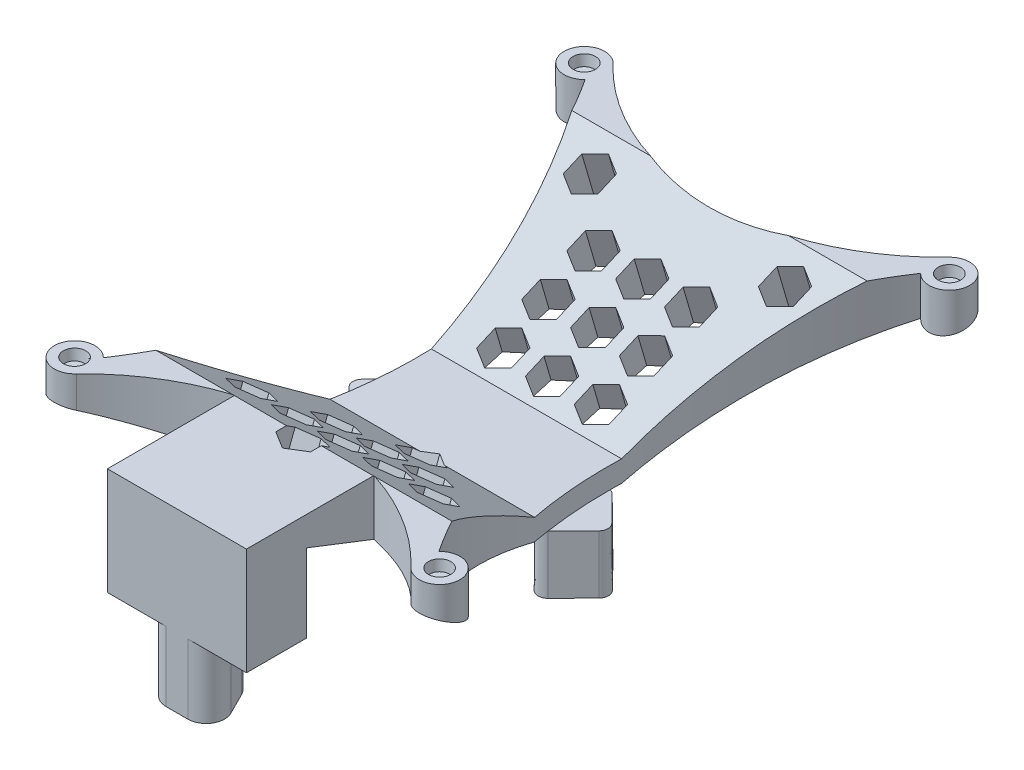
from build123d import *
from build123d.topology import SkipClean

# Parameters (mm, degrees)
BOSS_EXTRUDE1_DEPTH           = 36.5
CUT_EXTRUDE1_DEPTH            = 98.865031656
SKETCH4_R                     = 1.935
CUT_EXTRUDE2_DEPTH            = 1.7526
CUT_EXTRUDE2_DRAFT            = -8
CUT_EXTRUDE2_PROFILE_2_DEPTH  = 1.7526
CUT_EXTRUDE2_PROFILE_2_DRAFT  = -8
CUT_EXTRUDE2_PROFILE_3_DEPTH  = 1.7526
CUT_EXTRUDE2_PROFILE_3_DRAFT  = -8
CUT_EXTRUDE2_PROFILE_4_DEPTH  = 1.7526
CUT_EXTRUDE2_PROFILE_4_DRAFT  = -8
BOSS_EXTRUDE2_DEPTH           = 4.6228
FILLET1_R                     = 3.175
CUT_EXTRUDE4_START            = -18
CUT_EXTRUDE4_DEPTH            = 18
CUT_EXTRUDE6_DEPTH            = 50
CUT_EXTRUDE7_DEPTH            = 100
FILL_START                    = 16.923311585
FILL_PATTERN1_DEPTH           = 7.757240099
CUT_EXTRUDE8_DEPTH            = 100
FILL_START_2                  = 12.114170934
FILL_PATTERN2_DEPTH           = 8.855811696
BOSS_EXTRUDE4_DEPTH           = 10
BOSS_EXTRUDE4_DRAFT           = -0.5
BOSS_EXTRUDE4_PROFILE_2_DEPTH = 10
BOSS_EXTRUDE4_PROFILE_2_DRAFT = -0.5
CUT_EXTRUDE9_DEPTH            = 6


# Read off the part's stored shape, not the designer's step: Fill Pattern1, Fill Pattern2
with BuildPart() as part:
    # Sketch1 → Boss-Extrude1 (new body)
    with BuildSketch(Plane(origin=(0, 0, 0), x_dir=(1, 0, 0), z_dir=(0, 1, 0))):
        with BuildLine():
            Line((-12, -35.838693114), (-12, -57.838693114))
            Line((-12, -57.838693114), (12, -57.838693114))
            Line((12, -57.838693114), (12, -35.838693114))
            ThreePointArc((12, -35.838693114), (21.100135224, -40.014143909), (28.878256635, -46.318719847))
            ThreePointArc((28.878256635, -46.318719847), (34.99938562, -44.065576529), (28.966969845, -41.584682581))
            ThreePointArc((28.966969845, -41.584682581), (16.382626331, 0), (28.966969845, 41.584682581))
            ThreePointArc((28.966969845, 41.584682581), (34.998690641, 44.095727727), (28.838687388, 46.273194928))
            ThreePointArc((28.838687388, 46.273194928), (0, 33.991963114), (-28.838687388, 46.273194928))
            ThreePointArc((-28.838687388, 46.273194928), (-34.998690641, 44.095727727), (-28.966969845, 41.584682581))
            ThreePointArc((-28.966969845, 41.584682581), (-16.382626331, 0), (-28.966969845, -41.584682581))
            ThreePointArc((-28.966969845, -41.584682581), (-34.99938562, -44.065576529), (-28.878256635, -46.318719847))
            ThreePointArc((-28.878256635, -46.318719847), (-21.100135224, -40.014143909), (-12, -35.838693114))
        make_face()
    extrude(amount=BOSS_EXTRUDE1_DEPTH)

    # Sketch2 → Cut-Extrude1 (cut, through all)
    with BuildSketch(Plane(origin=(35, 0, 0), x_dir=(0, 0, -1), z_dir=(1, 0, 0))):
        Polygon((47.5, 31.5), (47.5, 18.360025762), (47.5, 0), (-3.679030534, 0), (-47.5, 0), (-47.5, 18.360025762), (-47.5, 31.5), (-13.761324108, 18.360025762), (2.5, 18.360025762), align=None)
    extrude(amount=-CUT_EXTRUDE1_DEPTH, mode=Mode.SUBTRACT)


with BuildPart() as cut_extrude2_tool:
    # Sketch4 → Cut-Extrude2 (with draft: the straight prism first)
    with BuildSketch(Plane(origin=(0, 36.5, 0), x_dir=(1, 0, 0), z_dir=(0, 1, 0))):
        with Locations((31.5, 44)):
            Circle(SKETCH4_R)
    extrude(amount=-CUT_EXTRUDE2_DEPTH)
    # Cut-Extrude2: the draft: its side faces are tilted about the plane it starts from
    cut_extrude2_sides = [cut_extrude2_tool.faces().sort_by_distance(p)[0] for p in [
        (29.565, 35.6237, -44),
    ]]
    draft(cut_extrude2_sides, Plane(origin=(0, 36.5, 0), x_dir=(1, 0, 0), z_dir=(0, 1, 0)), CUT_EXTRUDE2_DRAFT)


with BuildPart() as part_1:
    add(part.part)

    # Cut-Extrude2: cut by cut_extrude2_tool
    add(cut_extrude2_tool.part, mode=Mode.SUBTRACT)


with BuildPart() as cut_extrude2_profile_2_tool:
    # Sketch4 → Cut-Extrude2 profile 2 (with draft: the straight prism first)
    with BuildSketch(Plane(origin=(0, 36.5, 0), x_dir=(1, 0, 0), z_dir=(0, 1, 0))):
        with Locations((-31.522, 44)):
            Circle(SKETCH4_R)
    extrude(amount=-CUT_EXTRUDE2_PROFILE_2_DEPTH)
    # Cut-Extrude2 profile 2: the draft: its side faces are tilted about the plane it starts from
    cut_extrude2_profile_2_sides = [cut_extrude2_profile_2_tool.faces().sort_by_distance(p)[0] for p in [
        (-33.457, 35.6237, -44),
    ]]
    draft(cut_extrude2_profile_2_sides, Plane(origin=(0, 36.5, 0), x_dir=(1, 0, 0), z_dir=(0, 1, 0)), CUT_EXTRUDE2_PROFILE_2_DRAFT)


with BuildPart() as part_2:
    add(part_1.part)

    # Cut-Extrude2 profile 2: cut by cut_extrude2_profile_2_tool
    add(cut_extrude2_profile_2_tool.part, mode=Mode.SUBTRACT)


with BuildPart() as cut_extrude2_profile_3_tool:
    # Sketch4 → Cut-Extrude2 profile 3 (with draft: the straight prism first)
    with BuildSketch(Plane(origin=(0, 36.5, 0), x_dir=(1, 0, 0), z_dir=(0, 1, 0))):
        with Locations((-31.522, -44)):
            Circle(SKETCH4_R)
    extrude(amount=-CUT_EXTRUDE2_PROFILE_3_DEPTH)
    # Cut-Extrude2 profile 3: the draft: its side faces are tilted about the plane it starts from
    cut_extrude2_profile_3_sides = [cut_extrude2_profile_3_tool.faces().sort_by_distance(p)[0] for p in [
        (-33.457, 35.6237, 44),
    ]]
    draft(cut_extrude2_profile_3_sides, Plane(origin=(0, 36.5, 0), x_dir=(1, 0, 0), z_dir=(0, 1, 0)), CUT_EXTRUDE2_PROFILE_3_DRAFT)


with BuildPart() as part_3:
    add(part_2.part)

    # Cut-Extrude2 profile 3: cut by cut_extrude2_profile_3_tool
    add(cut_extrude2_profile_3_tool.part, mode=Mode.SUBTRACT)


with BuildPart() as cut_extrude2_profile_4_tool:
    # Sketch4 → Cut-Extrude2 profile 4 (with draft: the straight prism first)
    with BuildSketch(Plane(origin=(0, 36.5, 0), x_dir=(1, 0, 0), z_dir=(0, 1, 0))):
        with Locations((31.5, -44)):
            Circle(SKETCH4_R)
    extrude(amount=-CUT_EXTRUDE2_PROFILE_4_DEPTH)
    # Cut-Extrude2 profile 4: the draft: its side faces are tilted about the plane it starts from
    cut_extrude2_profile_4_sides = [cut_extrude2_profile_4_tool.faces().sort_by_distance(p)[0] for p in [
        (29.565, 35.6237, 44),
    ]]
    draft(cut_extrude2_profile_4_sides, Plane(origin=(0, 36.5, 0), x_dir=(1, 0, 0), z_dir=(0, 1, 0)), CUT_EXTRUDE2_PROFILE_4_DRAFT)


with BuildPart() as part_4:
    add(part_3.part)

    # Cut-Extrude2 profile 4: cut by cut_extrude2_profile_4_tool
    add(cut_extrude2_profile_4_tool.part, mode=Mode.SUBTRACT)

    # Sketch9 → Boss-Extrude2 (add)
    with BuildSketch(Plane.XZ):
        Polygon((7, 57.838693114), (-7, 57.838693114), (0, 43.838693114), align=None)
    extrude(amount=BOSS_EXTRUDE2_DEPTH)

    # Fillet1
    # the kernel refuses this fillet: 3.175 mm, written as the material it takes off along each edge
    with BuildSketch(Plane(origin=(0, 0, 43.838693114), x_dir=(0.44721359549995787, 0, 0.8944271909999159), z_dir=(0, -1, 0))) as fillet1_piece_1:
        with BuildLine():
            CenterArc((FILLET1_R * 2, FILLET1_R), FILLET1_R, 143.130102354, 126.869897646)
            Line((FILLET1_R * 1.2, FILLET1_R * 1.6), (0, 0))
            Line((0, 0), (FILLET1_R * 2, 0))
        make_face()
    extrude(amount=20.4978, mode=Mode.SUBTRACT)
    with BuildSketch(Plane(origin=(7, 0, 57.838693114), x_dir=(-1, 0, 0), z_dir=(0, -1, 0))) as fillet1_piece_2:
        with BuildLine():
            CenterArc((FILLET1_R * 1.61803398875, FILLET1_R), FILLET1_R, 153.434948823, 116.565051177)
            Line((FILLET1_R * 0.72360679775, FILLET1_R * 1.4472135955), (0, 0))
            Line((0, 0), (FILLET1_R * 1.61803398875, 0))
        make_face()
    extrude(amount=17.465944786, mode=Mode.SUBTRACT)
    with BuildSketch(Plane(origin=(-7, 0, 57.838693114), x_dir=(1, 0, 0), z_dir=(0, -1, 0))) as fillet1_piece_3:
        with BuildLine():
            CenterArc((FILLET1_R * 1.61803398875, -FILLET1_R), FILLET1_R, 90, 116.565051177)
            Line((FILLET1_R * 0.72360679775, -FILLET1_R * 1.4472135955), (0, 0))
            Line((0, 0), (FILLET1_R * 1.61803398875, 0))
        make_face()
    extrude(amount=17.465944786, mode=Mode.SUBTRACT)

    # Sketch23 → Cut-Extrude4 (cut)
    with SkipClean():  # the faces are left unmerged after this step: merging them gives an invalid solid
        with BuildSketch(Plane.XZ.offset(CUT_EXTRUDE4_START)):
            with BuildLine():
                ThreePointArc((1.862742086, 57.838693114), (4.563558402, 56.332889395), (4.702548417, 53.243789948))
                Line((4.702548417, 53.243789948), (2.839806331, 49.518305777))
                ThreePointArc((2.839806331, 49.518305777), (0, 47.763208942), (-2.839806331, 49.518305777))
                Line((-2.839806331, 49.518305777), (-4.702548417, 53.243789948))
                ThreePointArc((-4.702548417, 53.243789948), (-4.563558402, 56.332889395), (-1.862742086, 57.838693114))
                Line((-1.862742086, 57.838693114), (-12, 57.838693114))
                Line((-12, 57.838693114), (-12, 47.5))
                Line((-12, 47.5), (12, 47.5))
                Line((12, 47.5), (12, 57.838693114))
                Line((12, 57.838693114), (1.862742086, 57.838693114))
            make_face()
        extrude(amount=CUT_EXTRUDE4_DEPTH, mode=Mode.SUBTRACT)

    # Sketch15 → Cut-Extrude6 (cut, symmetric)
    with BuildSketch(Plane(origin=(-12.359159139, 18.360025762, 1.236220339), x_dir=(0, 0, 1), z_dir=(-1, 0, 0))):
        Polygon((-37.052321788, 18.139974238), (-3.736220339, 3.674033336), (12.525103769, 3.674033336), (34.69981047, 18.139974238), align=None)
    extrude(amount=CUT_EXTRUDE6_DEPTH, both=True, mode=Mode.SUBTRACT)

    # Sketch25 → Cut-Extrude7 (cut)
    with BuildSketch(Plane(origin=(0, 16.244925312, 4.743508891), x_dir=(-1, 0, 0), z_dir=(0, -0.9599140942773268, -0.28029436599357355))):
        Polygon((0, 9.894732418), (3, 11.626783225), (3, 15.09088484), (0, 16.822935648), (-3, 15.09088484), (-3, 11.626783225), align=None)
    extrude(amount=-CUT_EXTRUDE7_DEPTH, mode=Mode.SUBTRACT)

    # Fill Pattern1 outline → Fill Pattern1 (cut)
    with BuildSketch(Plane(origin=(0, 0, 0), x_dir=(1, 0, 0), z_dir=(0, 0.9599140942773268, 0.2802943659935737)).offset(FILL_START)):
        Polygon((0, 26.744253388), (3, 28.476304195), (3, 31.940405811), (0, 33.672456618), (-3, 31.940405811), (-3, 28.476304195), align=None)
        Polygon((0, 18.319492903), (3, 20.05154371), (3, 23.515645326), (0, 25.247696133), (-3, 23.515645326), (-3, 20.05154371), align=None)
        Polygon((5.424760485, 11.626783225), (8.424760485, 9.894732418), (11.424760485, 11.626783225), (11.424760485, 15.09088484), (8.424760485, 16.822935648), (5.424760485, 15.09088484), align=None)
        Polygon((8.424760485, 26.744253388), (11.424760485, 28.476304195), (11.424760485, 31.940405811), (8.424760485, 33.672456618), (5.424760485, 31.940405811), (5.424760485, 28.476304195), align=None)
        Polygon((8.424760485, 18.319492903), (11.424760485, 20.05154371), (11.424760485, 23.515645326), (8.424760485, 25.247696133), (5.424760485, 23.515645326), (5.424760485, 20.05154371), align=None)
        Polygon((-11.424760485, 28.476304195), (-8.424760485, 26.744253388), (-5.424760485, 28.476304195), (-5.424760485, 31.940405811), (-8.424760485, 33.672456618), (-11.424760485, 31.940405811), align=None)
        Polygon((-8.424760485, 18.319492903), (-5.424760485, 20.05154371), (-5.424760485, 23.515645326), (-8.424760485, 25.247696133), (-11.424760485, 23.515645326), (-11.424760485, 20.05154371), align=None)
        Polygon((-8.424760485, 9.894732418), (-5.424760485, 11.626783225), (-5.424760485, 15.09088484), (-8.424760485, 16.822935648), (-11.424760485, 15.09088484), (-11.424760485, 11.626783225), align=None)
        Polygon((13.84952097, 36.90106468), (16.84952097, 35.169013873), (19.84952097, 36.90106468), (19.84952097, 40.365166296), (16.84952097, 42.097217103), (13.84952097, 40.365166296), align=None)
        Polygon((-19.84952097, 36.90106468), (-16.84952097, 35.169013873), (-13.84952097, 36.90106468), (-13.84952097, 40.365166296), (-16.84952097, 42.097217103), (-19.84952097, 40.365166296), align=None)
    extrude(amount=FILL_PATTERN1_DEPTH, mode=Mode.SUBTRACT)

    # Sketch26 → Cut-Extrude8 (cut)
    with SkipClean():  # the faces are left unmerged after this step: merging them gives an invalid solid
        with BuildSketch(Plane(origin=(0, 11.288272361, -4.396367198), x_dir=(1, 0, 0), z_dir=(0, -0.9318237642182001, 0.36291110817695343))):
            Polygon((0, 26.535681859), (-3, 24.803631051), (-3, 21.339529436), (0, 19.607478629), (3, 21.339529436), (3, 24.803631051), align=None)
        extrude(amount=-CUT_EXTRUDE8_DEPTH, mode=Mode.SUBTRACT)

    # Fill Pattern2 outline → Fill Pattern2 (cut)
    with SkipClean():  # the faces are left unmerged after this step: merging them gives an invalid solid
        with BuildSketch(Plane(origin=(0, 0, 0), x_dir=(1, 0, 0), z_dir=(0, 0.9318237642182, -0.3629111081769533)).offset(FILL_START_2)):
            Polygon((0, -42.297607089), (3, -40.565556281), (3, -37.101454666), (0, -35.369403859), (-3, -37.101454666), (-3, -40.565556281), align=None)
            Polygon((0, -50.178569704), (3, -48.446518896), (3, -44.982417281), (0, -43.250366474), (-3, -44.982417281), (-3, -48.446518896), align=None)
            Polygon((0, -34.416644474), (3, -32.684593666), (3, -29.220492051), (0, -27.488441244), (-3, -29.220492051), (-3, -32.684593666), align=None)
            Polygon((4.880962615, -32.684593666), (7.880962615, -34.416644474), (10.880962615, -32.684593666), (10.880962615, -29.220492051), (7.880962615, -27.488441244), (4.880962615, -29.220492051), align=None)
            Polygon((7.880962615, -42.297607089), (10.880962615, -40.565556281), (10.880962615, -37.101454666), (7.880962615, -35.369403859), (4.880962615, -37.101454666), (4.880962615, -40.565556281), align=None)
            Polygon((-10.880962615, -40.565556281), (-7.880962615, -42.297607089), (-4.880962615, -40.565556281), (-4.880962615, -37.101454666), (-7.880962615, -35.369403859), (-10.880962615, -37.101454666), align=None)
            Polygon((-7.880962615, -34.416644474), (-4.880962615, -32.684593666), (-4.880962615, -29.220492051), (-7.880962615, -27.488441244), (-10.880962615, -29.220492051), (-10.880962615, -32.684593666), align=None)
            Polygon((12.76192523, -40.565556281), (15.76192523, -42.297607089), (18.76192523, -40.565556281), (18.76192523, -37.101454666), (15.76192523, -35.369403859), (12.76192523, -37.101454666), align=None)
            Polygon((-18.76192523, -40.565556281), (-15.76192523, -42.297607089), (-12.76192523, -40.565556281), (-12.76192523, -37.101454666), (-15.76192523, -35.369403859), (-18.76192523, -37.101454666), align=None)
        extrude(amount=FILL_PATTERN2_DEPTH, mode=Mode.SUBTRACT)


with BuildPart() as boss_extrude4_tool:
    # Sketch30 → Boss-Extrude4 (with draft: the straight prism first)
    with BuildSketch(Plane.XZ.offset(-18.360025762)):
        with BuildLine():
            Line((-17.198920753, 10.984248026), (-21.557475794, 6.55791926))
            ThreePointArc((-21.557475794, 6.55791926), (-22.013817318, 5.444080515), (-21.557475794, 4.330241769))
            Line((-21.557475794, 4.330241769), (-17.198920753, -0.096086997))
            ThreePointArc((-17.198920753, -0.096086997), (-15.465914219, -0.451239458), (-14.480262276, 1.017751749))
            Line((-14.480262276, 1.017751749), (-14.480262276, 9.87040928))
            ThreePointArc((-14.480262276, 9.87040928), (-15.465914219, 11.339400487), (-17.198920753, 10.984248026))
        make_face()
    extrude(amount=BOSS_EXTRUDE4_DEPTH)
    # Boss-Extrude4: the draft: its side faces are tilted about the plane it starts from
    boss_extrude4_sides = [boss_extrude4_tool.faces().sort_by_distance(p)[0] for p in [
        (-19.378198273, 13.360025762, 8.771083643),
        (-22.013817318, 13.360025762, 5.444080515),
        (-19.378198273, 13.360025762, 2.117077386),
        (-15.465914219, 13.360025762, -0.451239458),
        (-14.480262276, 13.360025762, 5.444080515),
        (-15.465914219, 13.360025762, 11.339400487),
    ]]
    draft(boss_extrude4_sides, Plane.XZ.offset(-18.360025762), BOSS_EXTRUDE4_DRAFT)


with BuildPart() as part_5:
    add(part_4.part)

    # Boss-Extrude4: add boss_extrude4_tool
    add(boss_extrude4_tool.part)


with BuildPart() as boss_extrude4_profile_2_tool:
    # Sketch30 → Boss-Extrude4 profile 2 (with draft: the straight prism first)
    with BuildSketch(Plane.XZ.offset(-18.360025762)):
        with BuildLine():
            ThreePointArc((14.476002276, 1.017751749), (15.461654219, -0.451239458), (17.194660753, -0.096086997))
            Line((17.194660753, -0.096086997), (21.553215794, 4.330241769))
            ThreePointArc((21.553215794, 4.330241769), (22.009557318, 5.444080515), (21.553215794, 6.55791926))
            Line((21.553215794, 6.55791926), (17.194660753, 10.984248026))
            ThreePointArc((17.194660753, 10.984248026), (15.461654219, 11.339400487), (14.476002276, 9.87040928))
            Line((14.476002276, 9.87040928), (14.476002276, 1.017751749))
        make_face()
    extrude(amount=BOSS_EXTRUDE4_PROFILE_2_DEPTH)
    # Boss-Extrude4 profile 2: the draft: its side faces are tilted about the plane it starts from
    boss_extrude4_profile_2_sides = [boss_extrude4_profile_2_tool.faces().sort_by_distance(p)[0] for p in [
        (15.461654219, 13.360025762, -0.451239458),
        (19.373938273, 13.360025762, 2.117077386),
        (22.009557318, 13.360025762, 5.444080515),
        (19.373938273, 13.360025762, 8.771083643),
        (15.461654219, 13.360025762, 11.339400487),
        (14.476002276, 13.360025762, 5.444080515),
    ]]
    draft(boss_extrude4_profile_2_sides, Plane.XZ.offset(-18.360025762), BOSS_EXTRUDE4_PROFILE_2_DRAFT)


with BuildPart() as part_6:
    add(part_5.part)

    # Boss-Extrude4 profile 2: add boss_extrude4_profile_2_tool
    add(boss_extrude4_profile_2_tool.part)

    # Sketch22 → Cut-Extrude9 (cut, symmetric)
    with BuildSketch(Plane.XZ):
        with BuildLine():
            Line((1.862742086, 57.838693114), (-1.862742086, 57.838693114))
            ThreePointArc((-1.862742086, 57.838693114), (-4.563558402, 56.332889395), (-4.702548417, 53.243789948))
            Line((-4.702548417, 53.243789948), (-2.839806331, 49.518305777))
            ThreePointArc((-2.839806331, 49.518305777), (0, 47.763208942), (2.839806331, 49.518305777))
            Line((2.839806331, 49.518305777), (4.702548417, 53.243789948))
            ThreePointArc((4.702548417, 53.243789948), (4.563558402, 56.332889395), (1.862742086, 57.838693114))
        make_face()
    extrude(amount=CUT_EXTRUDE9_DEPTH, both=True, mode=Mode.SUBTRACT)


solid = part_6.part
